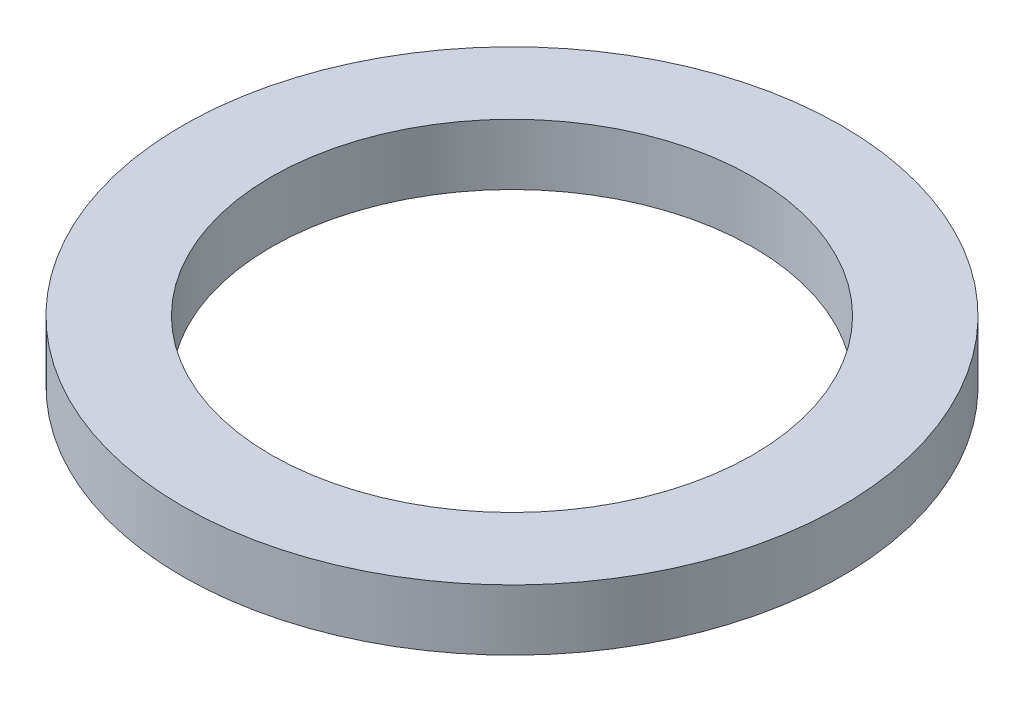
from build123d import *

# Parameters (mm, degrees)
SKETCH1_R           = 65
BOSS_EXTRUDE1_DEPTH = 12
SKETCH2_R           = 47.5
CUT_EXTRUDE1_DEPTH  = 93.703829479


with BuildPart() as part:
    # Sketch1 → Boss-Extrude1 (new body)
    with BuildSketch(Plane(origin=(0, 0, 0), x_dir=(1, 0, 0), z_dir=(0, 1, 0))):
        Circle(SKETCH1_R)
    extrude(amount=BOSS_EXTRUDE1_DEPTH)

    # Sketch2 → Cut-Extrude1 (cut, through all)
    with BuildSketch(Plane(origin=(0, 0, 0), x_dir=(1, 0, 0), z_dir=(0, 1, 0))):
        Circle(SKETCH2_R)
    extrude(amount=CUT_EXTRUDE1_DEPTH, mode=Mode.SUBTRACT)


solid = part.part
